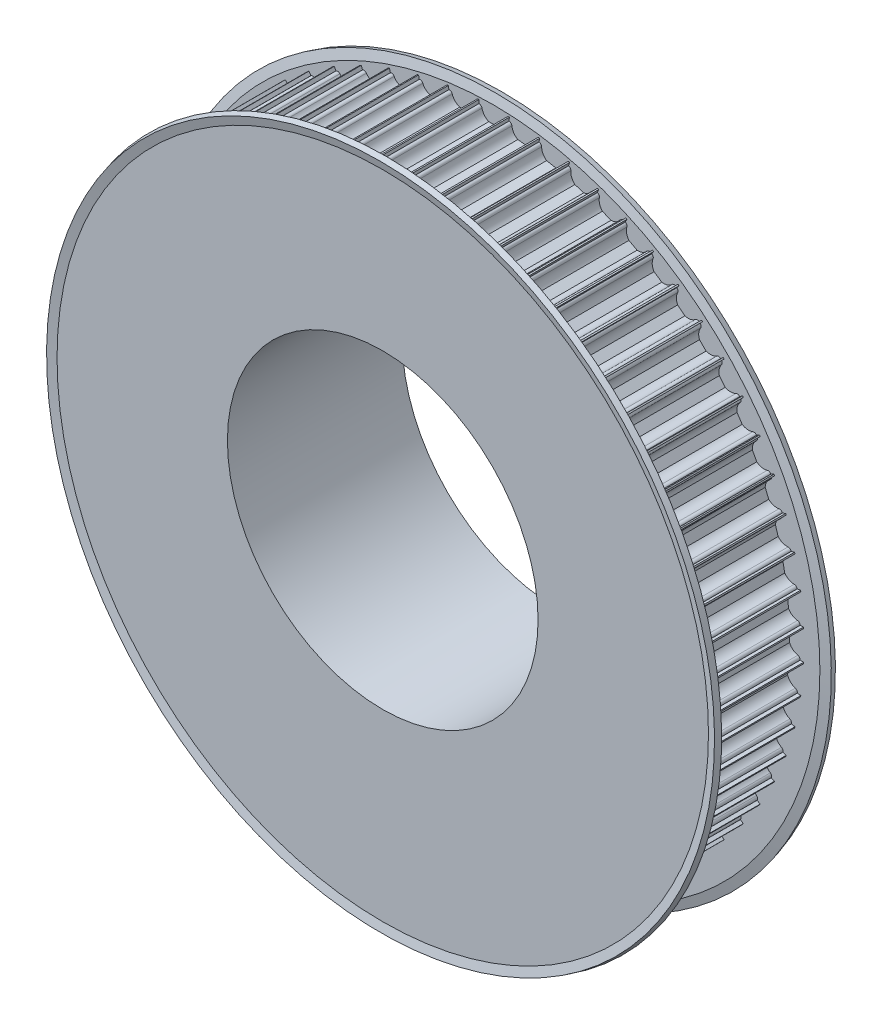
from build123d import *

# Parameters (mm, degrees)
CUT_EXTRUDE1_REACH = 126.731
CIRPATTERN1_COUNT  = 64


with BuildPart() as part:
    # Sketch1 → Revolve1 (revolve)
    with BuildSketch(Plane(origin=(0, 0, 0), x_dir=(0, 0, -1), z_dir=(1, 0, 0)), mode=Mode.PRIVATE) as revolve1_sk:
        Polygon((0, 44.456395349), (45, 44.456395349), (45, 59.956395349), (30, 59.956395349), (30, 84.456395349), (0, 84.456395349), align=None)
    revolve(revolve1_sk.sketch.rotate(Axis((0, 4.456395349, 0), (0, 0, -1)), 90), axis=Axis((0, 4.456395349, 0), (0, 0, -1)))

    # Sketch2 → Cut-Extrude1 (cut, up to next)
    with BuildSketch(Plane.XY, mode=Mode.PRIVATE) as cut_extrude1_sk1:
        with BuildLine():
            Line((-3.674234614, 83.456395349), (-3.75, 83.456395349))
            Line((-3.75, 83.456395349), (-3.75, 85.456395349))
            Line((-3.75, 85.456395349), (3.75, 85.456395349))
            Line((3.75, 85.456395349), (3.75, 83.456395349))
            Line((3.75, 83.456395349), (3.674234614, 83.456395349))
            ThreePointArc((3.674234614, 83.456395349), (3.199892965, 83.287342851), (2.939387691, 82.856395349))
            ThreePointArc((2.939387691, 82.856395349), (2.331759211, 81.56883105), (1.198957881, 80.706395349))
            Line((1.198957881, 80.706395349), (-1.198957881, 80.706395349))
            ThreePointArc((-1.198957881, 80.706395349), (-2.331759211, 81.56883105), (-2.939387691, 82.856395349))
            ThreePointArc((-2.939387691, 82.856395349), (-3.199892965, 83.287342851), (-3.674234614, 83.456395349))
        make_face()
    cut_extrude1_tool1 = extrude(cut_extrude1_sk1.sketch, amount=-CUT_EXTRUDE1_REACH, mode=Mode.PRIVATE) & part.part
    cut_extrude1 = cut_extrude1_tool1.solids().sort_by_distance((0, 83.391564, 0))[0]
    add(cut_extrude1, mode=Mode.SUBTRACT)

    # CirPattern1: Cut-Extrude1 ×64 about axis
    cirpattern1_axis = Axis((0, 4.456395349, 0), (0, 0, 1))
    for i in range(1, CIRPATTERN1_COUNT):
        add(cut_extrude1.rotate(cirpattern1_axis, i * 360 / CIRPATTERN1_COUNT), mode=Mode.SUBTRACT)

    # Sketch3 → Revolve3 (revolve)
    with BuildSketch(Plane(origin=(0, 0, 0), x_dir=(0, 0, -1), z_dir=(1, 0, 0))):
        Polygon((30, 59.956395349), (30, 84.868916602), (30.570054448, 86.996388764), (29.121165708, 87.384617332), (28.5, 85.066395349), (28.5, 59.956395349), align=None)
        Polygon((1.5, 85.066395349), (1.5, 59.956395349), (0, 59.956395349), (0, 84.868916602), (-0.570054448, 86.996388764), (0.878834292, 87.384617332), align=None)
    revolve(axis=Axis((0, 0.990435601, -15), (0, 0, 1)))


solid = part.part
